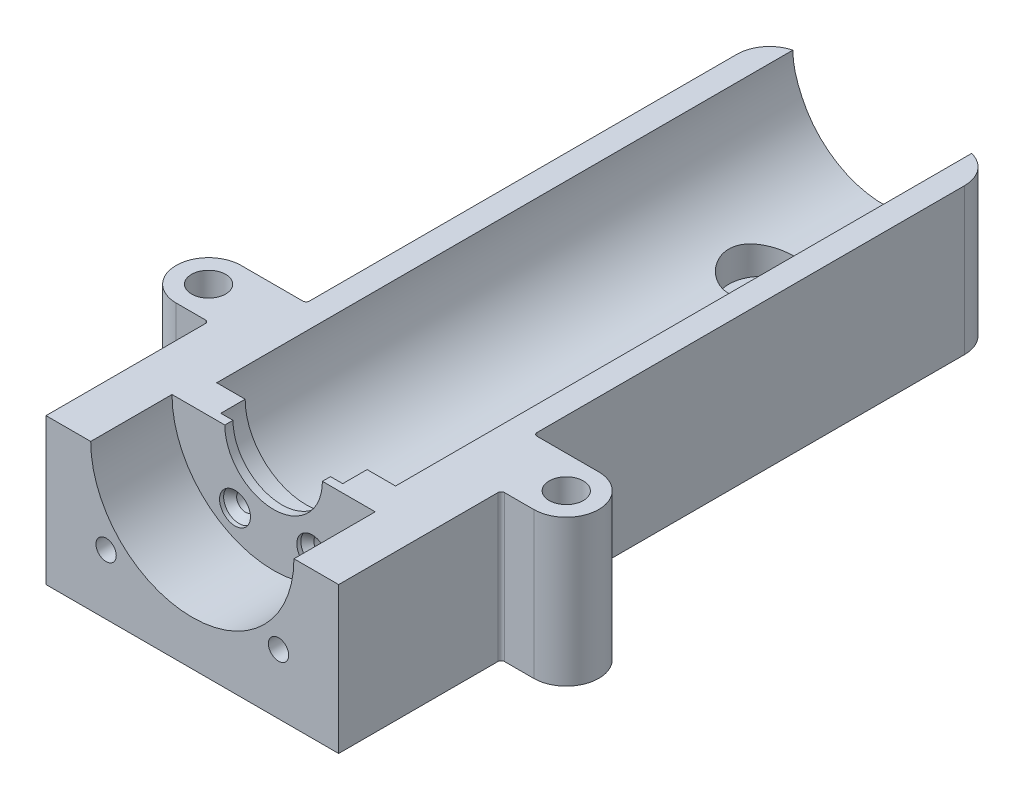
from build123d import *

# Parameters (mm, degrees)
REVOLVE_1_ANGLE                    = 180
EXTRUDE_START                      = -20
EXTRUDE_1_DEPTH                    = 20
EXTRUDE_2_REACH                    = 90.73
SKETCH_3_W                         = 28
SKETCH_3_H                         = 65
CUT_EXTRUDE_1_DEPTH                = 3
CUT_EXTRUDE_1_DEPTH_BACK           = 3
SKETCH_4_R                         = 4
CUT_EXTRUDE_2_REACH                = 90.006
SKETCH_5_R                         = 2.1
EXTRUDE_3_DEPTH                    = 18
CUT_EXTRUDE_3_REACH                = 92.692
SKETCH_7_R                         = 2.1
CUT_EXTRUDE_4_REACH                = 83.394
SKETCH_8_R                         = 1.1
SKETCH_9_R                         = 1.9
CUT_EXTRUDE_5_DEPTH                = 0.5
SKETCH_10_R                        = 1.9
CUT_EXTRUDE_6_DEPTH                = 1.2
CUT_EXTRUDE_6_DRAFT                = -45
PATTERN_CIRCULAR_1_COUNT           = 2
PATTERN_CIRCULAR_1_ANGLE           = 60
PATTERN_CIRCULAR_1_COPY_1_SKETCH_R = 1.9
PATTERN_CIRCULAR_1_COPY_1_DEPTH    = 1.2
PATTERN_CIRCULAR_1_COPY_1_DRAFT    = -45
HOLE_WIZARD_M31_AT_2_COUNT         = 2
HOLE_WIZARD_M31_AT_2_PITCH         = 15
PATTERN_CIRCULAR_2_COUNT           = 2
PATTERN_CIRCULAR_2_ANGLE           = 90
FILLET_1_R                         = 0.4
FILLET_2_R                         = 4


# Read off the part's stored shape, not the designer's step: Бобышка-Вытянуть1
with BuildPart() as part:
    # Эскиз1 → Повернуть1 (revolve)
    with BuildSketch(Plane(origin=(0, 0, 0), x_dir=(1, 0, 0), z_dir=(0, 1, 0))):
        Polygon((-11, 85), (-14, 85), (-14, 20), (-18, 20), (-18, 0), (-12.5, 0), (-12.5, 10), (-6, 10), (-6, 11), (-7.5, 11), (-7.5, 14), (-11, 14), align=None)
    revolve(axis=Axis((0, 0, 0), (0, 0, 1)), revolution_arc=REVOLVE_1_ANGLE)

    # Бобышка-Вытянуть1 outline → Бобышка-Вытянуть1 (add)
    with BuildSketch(Plane.XY.offset(EXTRUDE_START)):
        with BuildLine():
            Line((-18, -18), (0, -18))
            ThreePointArc((0, -18), (-12.727922061, -12.727922061), (-18, 0))
            Line((-18, 0), (-18, -18))
        make_face()
        with BuildLine():
            Line((18, -18), (18, 0))
            ThreePointArc((18, 0), (12.727922061, -12.727922061), (0, -18))
            Line((0, -18), (18, -18))
        make_face()
    extrude(amount=EXTRUDE_1_DEPTH)

    # Эскиз3 → Бобышка-Вытянуть2 (add, up to next)
    with BuildSketch(Plane(origin=(0, -18, 0), x_dir=(1, 0, 0), z_dir=(0, 1, 0)), mode=Mode.PRIVATE) as extrude_2_sk1:
        with Locations((0, 52.5)):
            Rectangle(SKETCH_3_W, SKETCH_3_H)
    extrude_2_tool1 = extrude(extrude_2_sk1.sketch, amount=EXTRUDE_2_REACH, mode=Mode.PRIVATE) - part.part
    add(extrude_2_tool1.solids().sort_by_distance((0, -18, -52.5))[0])

    # Эскиз4 → Вырез-Вытянуть1 (cut, two sides: drawn at the far end of the back side and taken through both)
    with BuildSketch(Plane(origin=(0, -11, 0), x_dir=(1, 0, 0), z_dir=(0, 1, 0)).offset(-CUT_EXTRUDE_1_DEPTH_BACK)):
        with Locations(Location((0, 70, 0), (0, 0, 90))):
            Circle(SKETCH_4_R)
    extrude(amount=CUT_EXTRUDE_1_DEPTH + CUT_EXTRUDE_1_DEPTH_BACK, mode=Mode.SUBTRACT)

    # Эскиз5 → Вырез-Вытянуть2 (cut, up to next)
    with BuildSketch(Plane(origin=(0, -14, 0), x_dir=(1, 0, 0), z_dir=(0, 1, 0)), mode=Mode.PRIVATE) as cut_extrude_2_sk1:
        with Locations(Location((0, 70, 0), (0, 0, 270))):
            Circle(SKETCH_5_R)
    cut_extrude_2_tool1 = extrude(cut_extrude_2_sk1.sketch, amount=-CUT_EXTRUDE_2_REACH, mode=Mode.PRIVATE) & part.part
    add(cut_extrude_2_tool1.solids().sort_by_distance((0, -14, -70))[0], mode=Mode.SUBTRACT)

    # Эскиз6 → Бобышка-Вытянуть3 (add)
    with BuildSketch(Plane(origin=(0, -18, 0), x_dir=(1, 0, 0), z_dir=(0, 1, 0))):
        with BuildLine():
            Line((14, 20), (22, 20))
            ThreePointArc((22, 20), (26, 24), (22, 28))
            Line((22, 28), (14, 28))
            Line((14, 28), (14, 20))
        make_face()
    extrude_3 = extrude(amount=EXTRUDE_3_DEPTH)

    # Эскиз7 → Вырез-Вытянуть3 (cut, up to next)
    with BuildSketch(Plane(origin=(0, 0, 0), x_dir=(1, 0, 0), z_dir=(0, 1, 0)), mode=Mode.PRIVATE) as cut_extrude_3_sk1:
        with Locations(Location((22, 24, 0), (0, 0, 180))):
            Circle(SKETCH_7_R)
    cut_extrude_3_tool1 = extrude(cut_extrude_3_sk1.sketch, amount=-CUT_EXTRUDE_3_REACH, mode=Mode.PRIVATE) & part.part
    cut_extrude_3 = cut_extrude_3_tool1.solids().sort_by_distance((22, 0, -24))[0]
    add(cut_extrude_3, mode=Mode.SUBTRACT)

    # Зеркальное отражение1: Бобышка-Вытянуть3, Вырез-Вытянуть3 across plane
    add(extrude_3.mirror(Plane(origin=(0, 0, 0), x_dir=(0, 0, 1), z_dir=(1, 0, 0))))
    add(cut_extrude_3.mirror(Plane(origin=(0, 0, 0), x_dir=(0, 0, 1), z_dir=(1, 0, 0))), mode=Mode.SUBTRACT)

    # Эскиз8 → Вырез-Вытянуть4 (cut, up to next)
    with BuildSketch(Plane.XY.offset(-10), mode=Mode.PRIVATE) as cut_extrude_4_sk1:
        with Locations((-4.75, -8.227241336)):
            Circle(SKETCH_8_R)
    cut_extrude_4_tool1 = extrude(cut_extrude_4_sk1.sketch, amount=-CUT_EXTRUDE_4_REACH, mode=Mode.PRIVATE) & part.part
    cut_extrude_4 = cut_extrude_4_tool1.solids().sort_by_distance((-4.75, -8.227241, -10))[0]
    add(cut_extrude_4, mode=Mode.SUBTRACT)

    # Эскиз9 → Вырез-Вытянуть5 (cut)
    with BuildSketch(Plane.XY.offset(-10)):
        with Locations((-4.75, -8.227241336)):
            Circle(SKETCH_9_R)
    cut_extrude_5 = extrude(amount=-CUT_EXTRUDE_5_DEPTH, mode=Mode.SUBTRACT)


with BuildPart() as cut_extrude_6_tool:
    # Эскиз10 → Вырез-Вытянуть6 (with draft: the straight prism first)
    with BuildSketch(Plane.XY.offset(-10.5)):
        with Locations((-4.75, -8.227241336)):
            Circle(SKETCH_10_R)
    extrude(amount=-CUT_EXTRUDE_6_DEPTH)
    # Вырез-Вытянуть6: the draft: its side faces are tilted about the plane it starts from
    cut_extrude_6_sides = [cut_extrude_6_tool.faces().sort_by_distance(p)[0] for p in [
        (-6.65, -8.227241336, -11.1),
    ]]
    draft(cut_extrude_6_sides, Plane.XY.offset(-10.5), CUT_EXTRUDE_6_DRAFT)


with BuildPart() as part_1:
    add(part.part)

    # Вырез-Вытянуть6: cut by cut_extrude_6_tool
    add(cut_extrude_6_tool.part, mode=Mode.SUBTRACT)

    # Круговой массив1: Вырез-Вытянуть4, Вырез-Вытянуть5 ×2 about axis
    pattern_circular_1_axis = Axis((0, 0, 0), (0, 0, 1))
    add([cut_extrude_4.rotate(pattern_circular_1_axis, i * PATTERN_CIRCULAR_1_ANGLE / (PATTERN_CIRCULAR_1_COUNT - 1)) for i in range(1, PATTERN_CIRCULAR_1_COUNT)], mode=Mode.SUBTRACT)
    add([cut_extrude_5.rotate(pattern_circular_1_axis, i * PATTERN_CIRCULAR_1_ANGLE / (PATTERN_CIRCULAR_1_COUNT - 1)) for i in range(1, PATTERN_CIRCULAR_1_COUNT)], mode=Mode.SUBTRACT)


with BuildPart() as pattern_circular_1_copy_1_tool:
    # Круговой массив1 copy 1 sketch → Круговой массив1 copy 1 (with draft: the straight prism first)
    with BuildSketch(Plane(origin=(0, 0, -10.5), x_dir=(0.4999999999999978, 0.8660254037844399, 0), z_dir=(0, 0, 1))):
        with Locations((-4.75, -8.227241336)):
            Circle(PATTERN_CIRCULAR_1_COPY_1_SKETCH_R)
    extrude(amount=-PATTERN_CIRCULAR_1_COPY_1_DEPTH)
    # Круговой массив1 copy 1: the draft: its side faces are tilted about the plane it starts from
    pattern_circular_1_copy_1_sides = [pattern_circular_1_copy_1_tool.faces().sort_by_distance(p)[0] for p in [
        (3.8, -9.872689603, -11.1),
    ]]
    draft(pattern_circular_1_copy_1_sides, Plane(origin=(0, 0, -10.5), x_dir=(0.4999999999999978, 0.8660254037844399, 0), z_dir=(0, 0, 1)), PATTERN_CIRCULAR_1_COPY_1_DRAFT)


with BuildPart() as part_2:
    add(part_1.part)

    # Круговой массив1 copy 1: cut by pattern_circular_1_copy_1_tool
    add(pattern_circular_1_copy_1_tool.part, mode=Mode.SUBTRACT)

    # Эскиз11 → Сверление под метчик M31 (revolve, cut)
    with BuildSketch(Plane(origin=(10.606601718, -10.606601718, 0), x_dir=(0, -1, 0), z_dir=(1, 0, 0))):
        Polygon((0, 0), (0, 15.751075774), (1.25, 15), (1.25, 0), align=None)
    hole_wizard_m31 = revolve(axis=Axis((10.606601718, -10.606601718, 6.35), (0, 0, -1)), mode=Mode.SUBTRACT)

    # Сверление под метчик M31 at 2: Сверление под метчик M31 ×2
    with Locations(*[Vector(-0.7071067811865464, 0.7071067811865487, 0) * (i * HOLE_WIZARD_M31_AT_2_PITCH) for i in range(1, HOLE_WIZARD_M31_AT_2_COUNT)]):
        add(hole_wizard_m31, mode=Mode.SUBTRACT)

    # Круговой массив2: Сверление под метчик M31 ×2 about axis
    pattern_circular_2_axis = Axis((0, 0, 0), (0, 0, -1))
    for i in range(1, PATTERN_CIRCULAR_2_COUNT):
        add(hole_wizard_m31.rotate(pattern_circular_2_axis, i * PATTERN_CIRCULAR_2_ANGLE / (PATTERN_CIRCULAR_2_COUNT - 1)), mode=Mode.SUBTRACT)

    # Круговой массив2 copy 1 sketch → Круговой массив2 copy 1 (revolve, cut)
    with BuildSketch(Plane(origin=(0, 0, 0), x_dir=(-1, 0, 0), z_dir=(0, -1, 0))):
        Polygon((0, 0), (0, 15.751075774), (1.25, 15), (1.25, 0), align=None)
    revolve(axis=Axis((0, 0, 6.35), (0, 0, -1)), mode=Mode.SUBTRACT)

    # Скругление1
    fillet_1_edges = [part_2.edges().sort_by_distance(p)[0] for p in [
        (18, -9, -20),
        (-18, -9, -20),
        (14, -9, -28),
        (-14, -9, -28),
    ]]
    fillet(fillet_1_edges, radius=FILLET_1_R)

    # Скругление2
    fillet_2_edges = [part_2.edges().sort_by_distance(p)[0] for p in [
        (-14, -9, -85),
        (14, -9, -85),
    ]]
    fillet(fillet_2_edges, radius=FILLET_2_R)


solid = part_2.part
